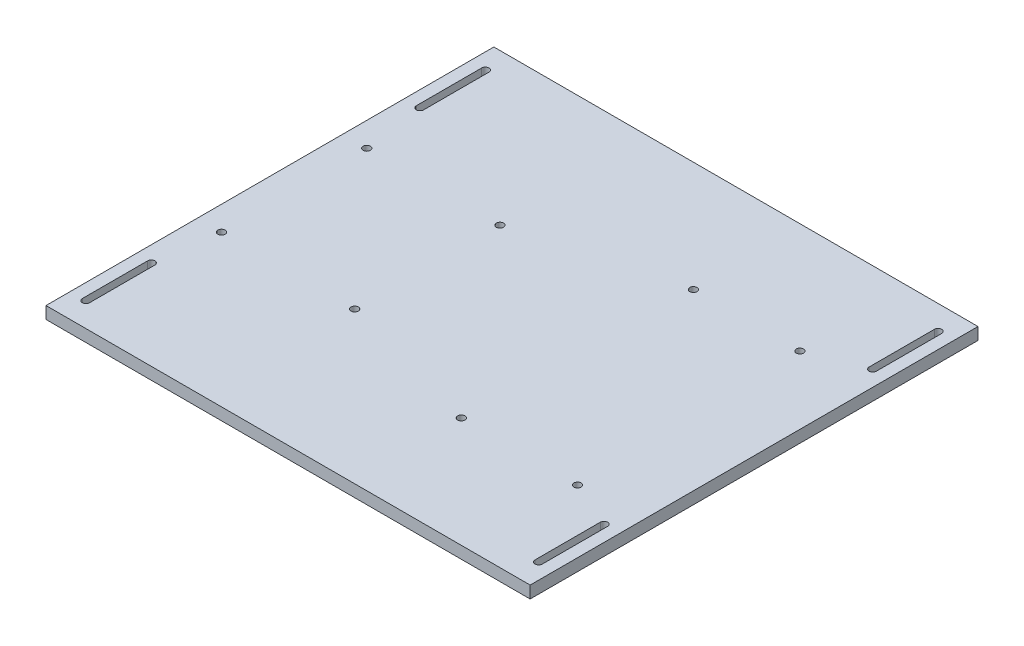
from build123d import *

# Parameters (mm, degrees)
SKETCH2_W           = 200
SKETCH2_H           = 185
BOSS_EXTRUDE1_DEPTH = 5
SKETCH3_R           = 1.5
CUT_EXTRUDE1_DEPTH  = 137.313058802
SKETCH4_R           = 1.5
CUT_EXTRUDE3_DEPTH  = 137.313058802


with BuildPart() as part:
    # Sketch2 → Boss-Extrude1 (new body)
    with BuildSketch(Plane(origin=(0, 0, 0), x_dir=(1, 0, 0), z_dir=(0, 1, 0))):
        Rectangle(SKETCH2_W, SKETCH2_H)
        with BuildLine():
            Line((-95, 55.5), (-95, 82.5))
            ThreePointArc((-95, 82.5), (-93.5, 84), (-92, 82.5))
            Line((-92, 82.5), (-92, 55.5))
            ThreePointArc((-92, 55.5), (-93.5, 54), (-95, 55.5))
        make_face(mode=Mode.SUBTRACT)
        with BuildLine():
            Line((95, 55.5), (95, 82.5))
            ThreePointArc((95, 82.5), (93.5, 84), (92, 82.5))
            Line((92, 82.5), (92, 55.5))
            ThreePointArc((92, 55.5), (93.5, 54), (95, 55.5))
        make_face(mode=Mode.SUBTRACT)
        with BuildLine():
            Line((95, -55.5), (95, -82.5))
            ThreePointArc((95, -82.5), (93.5, -84), (92, -82.5))
            Line((92, -82.5), (92, -55.5))
            ThreePointArc((92, -55.5), (93.5, -54), (95, -55.5))
        make_face(mode=Mode.SUBTRACT)
        with BuildLine():
            Line((-95, -55.5), (-95, -82.5))
            ThreePointArc((-95, -82.5), (-93.5, -84), (-92, -82.5))
            Line((-92, -82.5), (-92, -55.5))
            ThreePointArc((-92, -55.5), (-93.5, -54), (-95, -55.5))
        make_face(mode=Mode.SUBTRACT)
    extrude(amount=BOSS_EXTRUDE1_DEPTH)

    # Sketch3 → Cut-Extrude1 (cut, through all)
    with BuildSketch(Plane(origin=(0, 5, 0), x_dir=(1, 0, 0), z_dir=(0, 1, 0))):
        with Locations((-90, -30)):
            Circle(SKETCH3_R)
        with Locations((-90, 30)):
            Circle(SKETCH3_R)
        with Locations((-35, 30)):
            Circle(SKETCH3_R)
        with Locations((-35, -30)):
            Circle(SKETCH3_R)
    extrude(amount=-CUT_EXTRUDE1_DEPTH, mode=Mode.SUBTRACT)

    # Sketch4 → Cut-Extrude3 (cut, through all)
    with BuildSketch(Plane(origin=(0, 5, 0), x_dir=(1, 0, 0), z_dir=(0, 1, 0))):
        with Locations((28, 46.935)):
            Circle(SKETCH4_R)
        with Locations((72, 46.935)):
            Circle(SKETCH4_R)
        with Locations((26, -46.935)):
            Circle(SKETCH4_R)
        with Locations((74, -46.935)):
            Circle(SKETCH4_R)
    extrude(amount=-CUT_EXTRUDE3_DEPTH, mode=Mode.SUBTRACT)


solid = part.part
